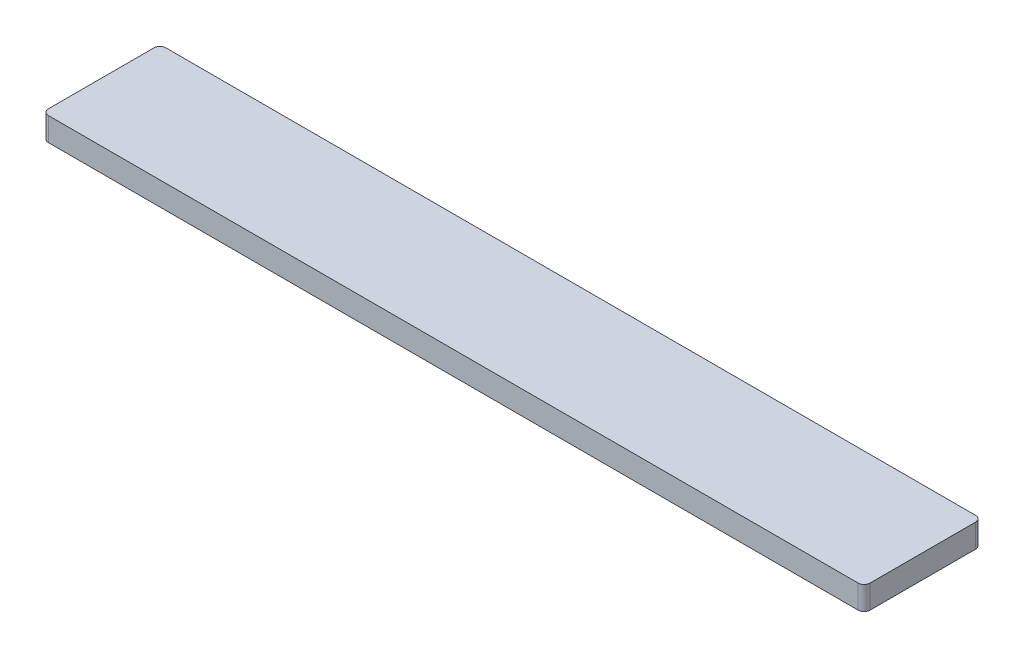
from build123d import *

# Parameters (mm, degrees)
SKETCH1_W           = 88.9
SKETCH1_H           = 12.7
BOSS_EXTRUDE1_DEPTH = 2.54
FILLET1_R           = 0.635
SHELL1_START        = 0.635
SHELL1_OUTLINE_W    = 1.905
SHELL1_OUTLINE_H    = 11.43
SHELL1_DEPTH        = 87.63
SKETCH2_R           = 2.54
BOSS_EXTRUDE2_DEPTH = 2.54


# Read off the part's stored shape, not the designer's step: Shell1
with BuildPart() as part:
    # Sketch1 → Boss-Extrude1 (new body)
    with BuildSketch(Plane(origin=(0, 0, 0), x_dir=(1, 0, 0), z_dir=(0, 1, 0))):
        with Locations((44.45, 6.35)):
            Rectangle(SKETCH1_W, SKETCH1_H)
    extrude(amount=BOSS_EXTRUDE1_DEPTH)

    # Fillet1
    fillet1_edges = [part.edges().sort_by_distance(p)[0] for p in [
        (0, 1.27, -12.7),
        (88.9, 1.27, -12.7),
        (88.9, 1.27, 0),
        (0, 1.27, 0),
    ]]
    fillet(fillet1_edges, radius=FILLET1_R)

    # Shell1 outline → Shell1 (cut)
    with BuildSketch(Plane.YZ.offset(SHELL1_START)):
        with Locations((0.9525, -6.35)):
            Rectangle(SHELL1_OUTLINE_W, SHELL1_OUTLINE_H)
    extrude(amount=SHELL1_DEPTH, mode=Mode.SUBTRACT)

    # Sketch2 → Boss-Extrude2 (add)
    with BuildSketch(Plane(origin=(0, 1.905, 0), x_dir=(-1, 0, 0), z_dir=(0, -1, 0))):
        with Locations(Location((-69.85, 6.35, 0), (0, 0, 270))):
            Circle(SKETCH2_R)
        with Locations(Location((-19.05, 6.35, 0), (0, 0, 270))):
            Circle(SKETCH2_R)
    extrude(amount=BOSS_EXTRUDE2_DEPTH)


solid = part.part
